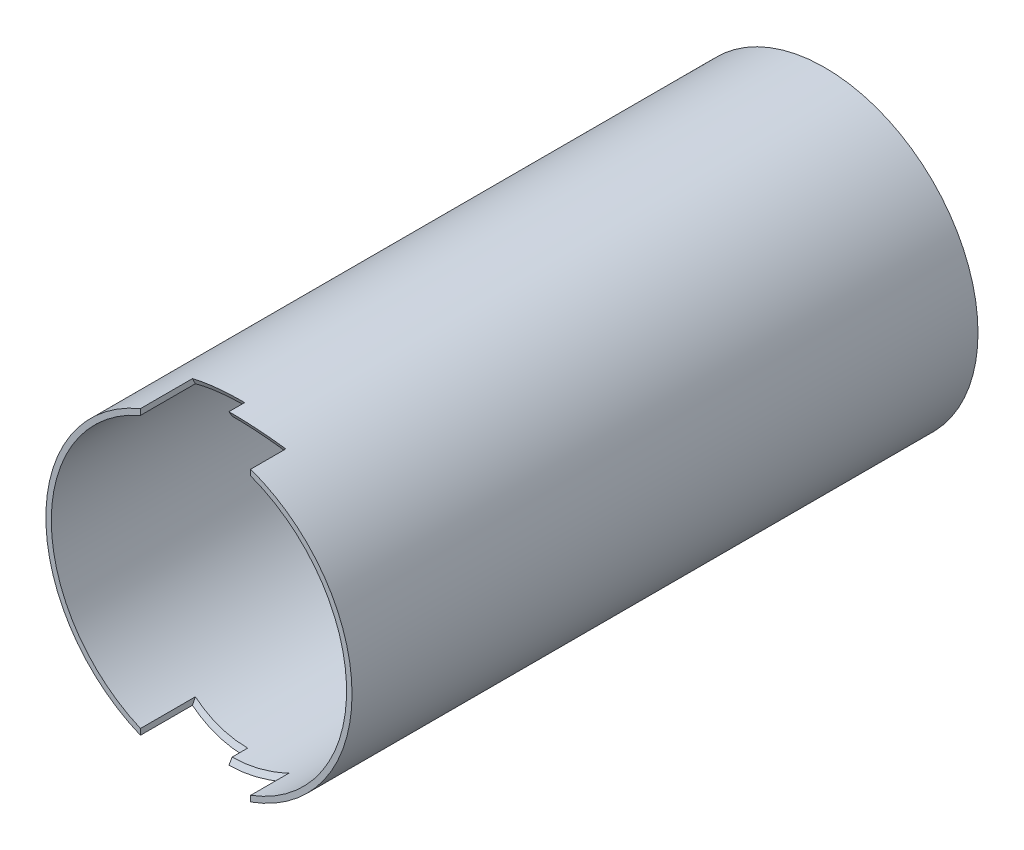
from build123d import *

# Parameters (mm, degrees)
SKETCH1_R           = 22.499999958
SKETCH1_R_2         = 21.699999958
BOSS_EXTRUDE1_DEPTH = 92
SKETCH3_R           = 45.65
CUT_EXTRUDE1_DEPTH  = 8.6
SKETCH3_3_R         = 43.65
CUT_EXTRUDE2_DEPTH  = 7.6


with BuildPart() as part:
    # Sketch1 → Boss-Extrude1 (new body)
    with BuildSketch(Plane(origin=(0, 0, 0), x_dir=(0, 1, 0), z_dir=(0, 0, 1))):
        Circle(SKETCH1_R)
        Circle(SKETCH1_R_2, mode=Mode.SUBTRACT)
    extrude(amount=BOSS_EXTRUDE1_DEPTH)

    # Sketch3 → Cut-Extrude1 (cut)
    with BuildSketch(Plane.YZ):
        with Locations((0, 125)):
            Circle(SKETCH3_R)
    extrude(amount=-CUT_EXTRUDE1_DEPTH, mode=Mode.SUBTRACT)

    # Sketch3<3> → Cut-Extrude2 (cut)
    with BuildSketch(Plane.YZ):
        with Locations((0, 125)):
            Circle(SKETCH3_3_R)
    extrude(amount=CUT_EXTRUDE2_DEPTH, mode=Mode.SUBTRACT)


solid = part.part
